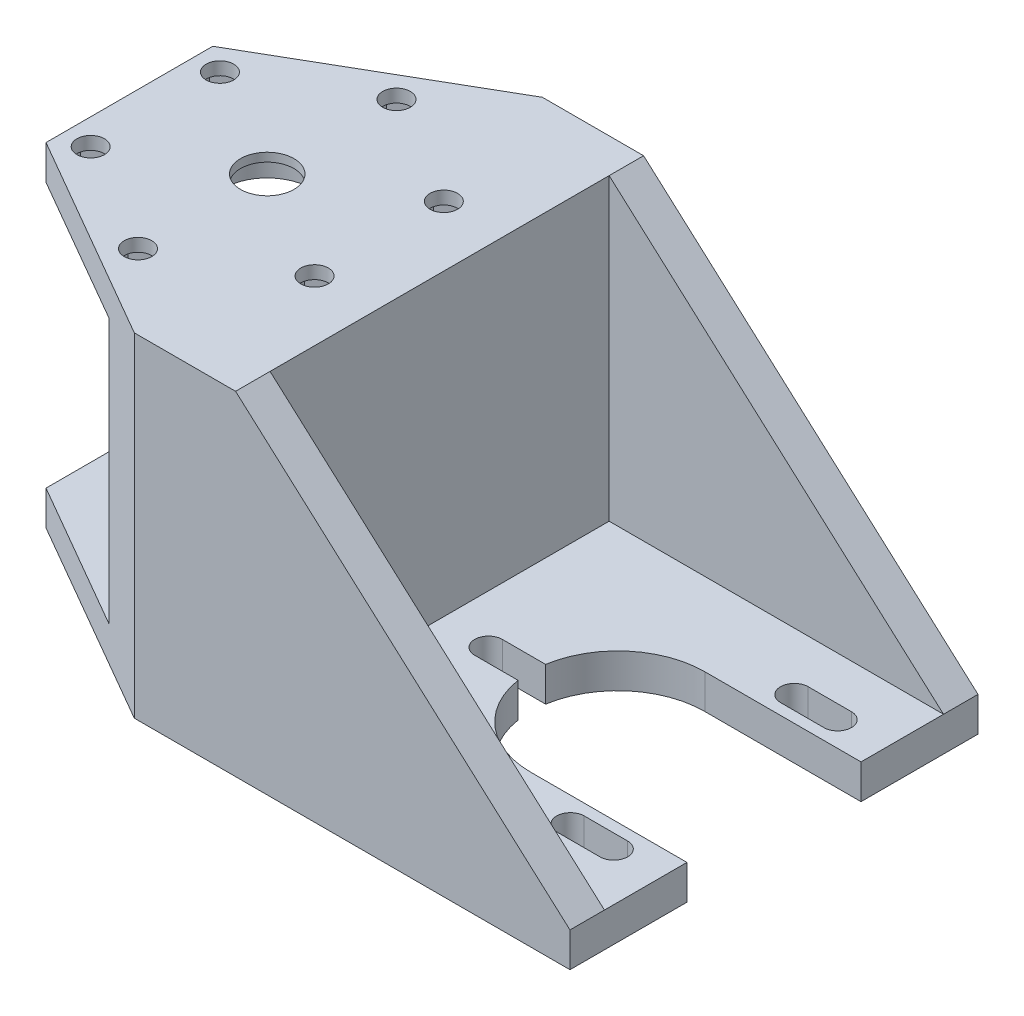
from build123d import *

# Parameters (mm, degrees)
BOSS_EXTRUDE1_DEPTH     = 39.35
CUT_EXTRUDE2_DEPTH      = 33.73
CUT_EXTRUDE2_DEPTH_BACK = 3
SKETCH3_R               = 5.1
CUT_EXTRUDE3_DEPTH      = 33.73
CUT_EXTRUDE4_DEPTH      = 87.647311883
CUT_EXTRUDE4_DEPTH_BACK = 87.647311883
SKETCH3_5_R             = 3.1
SKETCH3_5_R_2           = 10.1
SKETCH3_5_R_3           = 1.6
SKETCH3_5_W             = 20.675
SKETCH3_5_H             = 20.2
SKETCH3_5_W_2           = 5.027537917
SKETCH3_5_H_2           = 3.2
SKETCH3_5_W_3           = 5.03
SKETCH3_6_R             = 1.6
CUT_EXTRUDE5_DEPTH      = 87.647311883
SKETCH4_W               = 77.35
SKETCH4_H               = 38.73
BOSS_EXTRUDE2_DEPTH     = 4
SKETCH5_W               = 77.35
SKETCH5_H               = 38.73
BOSS_EXTRUDE3_DEPTH     = 4
CUT_EXTRUDE6_DEPTH      = 92.909209967
CUT_EXTRUDE6_DEPTH_BACK = 92.909209967
CUT_EXTRUDE7_DEPTH      = 2.5
CHAMFER1_SIZE           = 14
CHAMFER1_SIZE_2         = 24.248711306


with BuildPart() as part:
    # Sketch1 → Boss-Extrude1 (new body)
    with BuildSketch(Plane.XY):
        Polygon((-68.943174111, 38.106680783), (-32.943174111, 38.106680783), (-32.943174111, 3.376680783), (8.406825889, 3.376680783), (8.406825889, -0.623319217), (-68.943174111, -0.623319217), (-68.943174111, 3.376680783), (-36.943174111, 3.376680783), (-36.943174111, 34.106680783), (-68.943174111, 34.106680783), align=None)
    extrude(amount=BOSS_EXTRUDE1_DEPTH)

    # Sketch3 → Cut-Extrude2 (cut, two sides: drawn at the far end of the back side and taken through both)
    with BuildSketch(Plane(origin=(0, 3.376680783, 0), x_dir=(1, 0, 0), z_dir=(0, 1, 0)).offset(-CUT_EXTRUDE2_DEPTH_BACK)):
        with Locations(Location((-52.943174111, -19.675, 0), (0, 0, 90))):
            Circle(SKETCH3_R)
    extrude(amount=CUT_EXTRUDE2_DEPTH + CUT_EXTRUDE2_DEPTH_BACK, mode=Mode.SUBTRACT)

    # Sketch3<4> → Cut-Extrude3 (cut)
    with BuildSketch(Plane(origin=(0, 3.376680783, 0), x_dir=(1, 0, 0), z_dir=(0, 1, 0))):
        with BuildLine():
            Line((-47.58710279, -20.925), (-45.294644841, -20.925))
            Line((-45.294644841, -20.925), (-45.294644841, -18.425))
            Line((-45.294644841, -18.425), (-47.58710279, -18.425))
            ThreePointArc((-47.58710279, -18.425), (-47.479274758, -19.045870549), (-47.443174111, -19.675))
            ThreePointArc((-47.443174111, -19.675), (-47.479274758, -20.304129451), (-47.58710279, -20.925))
        make_face()
        with BuildLine():
            Line((-60.591703381, -18.425), (-60.591703381, -20.925))
            Line((-60.591703381, -20.925), (-58.299245432, -20.925))
            ThreePointArc((-58.299245432, -20.925), (-58.443174111, -19.675), (-58.299245432, -18.425))
            Line((-58.299245432, -18.425), (-60.591703381, -18.425))
        make_face()
    extrude(amount=CUT_EXTRUDE3_DEPTH, mode=Mode.SUBTRACT)

    # Sketch3<5> → Cut-Extrude4 (cut, two sides: drawn at the far end of the back side and taken through both)
    with BuildSketch(Plane(origin=(0, 3.376680783, 0), x_dir=(1, 0, 0), z_dir=(0, 1, 0)).offset(-CUT_EXTRUDE4_DEPTH_BACK)):
        with Locations(Location((-52.943174111, -19.675, 0), (0, 0, 270))):
            Circle(SKETCH3_5_R)
        with Locations((-12.268174111, -19.675)):
            Circle(SKETCH3_5_R_2)
        with Locations((-4.768174111, -32.665381057)):
            Circle(SKETCH3_5_R_3)
        with Locations((-4.768174111, -6.684618943)):
            Circle(SKETCH3_5_R_3)
        with Locations((-27.268174111, -19.675)):
            Circle(SKETCH3_5_R_3)
        with Locations((0.261825889, -32.665381057)):
            Circle(SKETCH3_5_R_3)
        with Locations((0.261825889, -6.684618943)):
            Circle(SKETCH3_5_R_3)
        with Locations((-1.930674111, -19.675)):
            Rectangle(SKETCH3_5_W, SKETCH3_5_H)
        with Locations((-24.754405152, -19.675)):
            Rectangle(SKETCH3_5_W_2, SKETCH3_5_H_2)
        with Locations((-2.253174111, -32.665381057)):
            Rectangle(SKETCH3_5_W_3, SKETCH3_5_H_2)
        with Locations((-2.253174111, -6.684618943)):
            Rectangle(SKETCH3_5_W_3, SKETCH3_5_H_2)
    extrude(amount=CUT_EXTRUDE4_DEPTH + CUT_EXTRUDE4_DEPTH_BACK, mode=Mode.SUBTRACT)

    # Sketch3<6> → Cut-Extrude5 (cut, through all)
    with BuildSketch(Plane(origin=(0, 3.376680783, 0), x_dir=(1, 0, 0), z_dir=(0, 1, 0))):
        with Locations(Location((-52.943174111, -34.675, 0), (0, 0, 180))):
            Circle(SKETCH3_6_R)
        with Locations(Location((-65.933555168, -27.175, 0), (0, 0, 180))):
            Circle(SKETCH3_6_R)
        with Locations(Location((-65.933555168, -12.175, 0), (0, 0, 180))):
            Circle(SKETCH3_6_R)
        with Locations(Location((-52.943174111, -4.675, 0), (0, 0, 180))):
            Circle(SKETCH3_6_R)
        with Locations(Location((-39.952793054, -12.175, 0), (0, 0, 180))):
            Circle(SKETCH3_6_R)
        with Locations(Location((-39.952793054, -27.175, 0), (0, 0, 180))):
            Circle(SKETCH3_6_R)
    extrude(amount=CUT_EXTRUDE5_DEPTH, mode=Mode.SUBTRACT)

    # Sketch4 → Boss-Extrude2 (add)
    with BuildSketch(Plane.XY.offset(39.35)):
        with Locations((-30.268174111, 18.741680783)):
            Rectangle(SKETCH4_W, SKETCH4_H)
    extrude(amount=BOSS_EXTRUDE2_DEPTH)

    # Sketch5 → Boss-Extrude3 (add)
    with BuildSketch(Plane(origin=(0, 0, 0), x_dir=(-1, 0, 0), z_dir=(0, 0, -1))):
        with Locations((30.268174111, 18.741680783)):
            Rectangle(SKETCH5_W, SKETCH5_H)
    extrude(amount=BOSS_EXTRUDE3_DEPTH)

    # Sketch6 → Cut-Extrude6 (cut, two sides: drawn at the far end of the back side and taken through both)
    with BuildSketch(Plane.XY.offset(43.35).offset(-CUT_EXTRUDE6_DEPTH_BACK)):
        Polygon((-32.943174111, 38.106680783), (5.861825889, 3.376680783), (5.861825889, -0.623319217), (8.406825889, -0.623319217), (8.406825889, 38.106680783), align=None)
    extrude(amount=CUT_EXTRUDE6_DEPTH + CUT_EXTRUDE6_DEPTH_BACK, mode=Mode.SUBTRACT)

    # Sketch8 → Cut-Extrude7 (cut)
    with BuildSketch(Plane.XZ.offset(-34.106680783)):
        Polygon((-65.933555168, 15.408161507), (-68.733555168, 13.791580754), (-68.733555168, 10.558419246), (-65.933555168, 8.941838493), (-63.133555168, 10.558419246), (-63.133555168, 13.791580754), align=None)
        Polygon((-65.933555168, 30.408161507), (-68.733555168, 28.791580754), (-68.733555168, 25.558419246), (-65.933555168, 23.941838493), (-63.133555168, 25.558419246), (-63.133555168, 28.791580754), align=None)
        Polygon((-52.943174111, 1.441838493), (-50.143174111, 3.058419246), (-50.143174111, 6.291580754), (-52.943174111, 7.908161507), (-55.743174111, 6.291580754), (-55.743174111, 3.058419246), align=None)
        Polygon((-39.952793054, 8.941838493), (-37.152793054, 10.558419246), (-37.152793054, 13.791580754), (-39.952793054, 15.408161507), (-42.752793054, 13.791580754), (-42.752793054, 10.558419246), align=None)
        Polygon((-39.952793054, 23.941838493), (-37.152793054, 25.558419246), (-37.152793054, 28.791580754), (-39.952793054, 30.408161507), (-42.752793054, 28.791580754), (-42.752793054, 25.558419246), align=None)
        Polygon((-52.943174111, 37.908161507), (-55.743174111, 36.291580754), (-55.743174111, 33.058419246), (-52.943174111, 31.441838493), (-50.143174111, 33.058419246), (-50.143174111, 36.291580754), align=None)
    extrude(amount=-CUT_EXTRUDE7_DEPTH, mode=Mode.SUBTRACT)

    # Chamfer1
    # the kernel refuses this chamfer: 24.248711306, 14 mm, written as the material it takes off along each edge
    with BuildSketch(Plane(origin=(-68.943174111, -63.356814805, 43.35), x_dir=(-0.05789386240267122, 0, -0.9983227437537925), z_dir=(0, 1, 0))) as chamfer1_piece_1:
        Polygon((CHAMFER1_SIZE * 0.998322743754, -CHAMFER1_SIZE * 0.0578938624027), (-CHAMFER1_SIZE_2 * 0.0578938624026, -CHAMFER1_SIZE_2 * 0.998322743752), (0, 0), align=None)
    extrude(amount=164.196991176, mode=Mode.SUBTRACT)
    with BuildSketch(Plane(origin=(-68.943174111, -63.356814805, -4), x_dir=(-0.05789386240267123, 0, 0.9983227437537925), z_dir=(0, 1, 0))) as chamfer1_piece_2:
        Polygon((CHAMFER1_SIZE * 0.998322743754, CHAMFER1_SIZE * 0.0578938624027), (-CHAMFER1_SIZE_2 * 0.0578938624026, CHAMFER1_SIZE_2 * 0.998322743752), (0, 0), align=None)
    extrude(amount=164.196991176, mode=Mode.SUBTRACT)


solid = part.part
